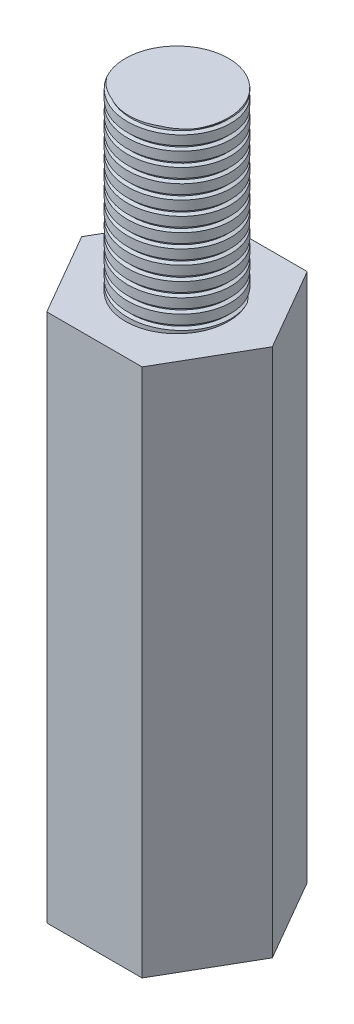
from build123d import *

# Parameters (mm, degrees)
SKETCH_1_R          = 1.46
EXTRUDE_1_DEPTH     = 15
SKETCH_1_3_R        = 1.46
CUT_EXTRUDE_1_DEPTH = 5
SKETCH_2_R          = 1.46
EXTRUDE_2_DEPTH     = 5
SWEEP_1_PITCH       = 0.4
SWEEP_1_FROM        = -0.1
SWEEP_2_PITCH       = 0.4


with BuildPart() as part:
    # 草图1 → 凸台-拉伸1 (new body)
    # profile 1 of 2: a face of its own
    with BuildSketch(Plane(origin=(0, 0, 0), x_dir=(1, 0, 0), z_dir=(0, 1, 0))):
        Polygon((-2.70199926, 0), (-1.35099963, -2.34), (1.35099963, -2.34), (2.70199926, 0), (1.35099963, 2.34), (-1.35099963, 2.34), align=None)
        Circle(SKETCH_1_R, mode=Mode.SUBTRACT)
    # profile 2 of 2: a face of its own
    with BuildSketch(Plane(origin=(0, 0, 0), x_dir=(1, 0, 0), z_dir=(0, 1, 0))):
        Circle(SKETCH_1_R)
    extrude(amount=EXTRUDE_1_DEPTH)

    # 草图1<3> → 切除-拉伸1 (cut)
    with BuildSketch(Plane(origin=(0, 0, 0), x_dir=(1, 0, 0), z_dir=(0, 1, 0))):
        with Locations(Location((0, 0, 0), (0, 0, 270))):
            Circle(SKETCH_1_3_R)
    extrude(amount=CUT_EXTRUDE_1_DEPTH, mode=Mode.SUBTRACT)

    # 切除-扫描2: arcs per turn and ends read off the stored shape
    # 切除-扫描2: the profile of 草图7 profile screwed along a right-hand helix through 23.75 turns, 6 arcs to a turn; built about Z, then put on its axis
    sweep_2_z = Axis((0, 0, 0), (0, 0, 1))
    sweep_2_corners = [(1.4597, 0, 0.1001), (1.66, 0, 0.033333333), (1.66, 0, -0.033333333), (1.4597, 0, -0.1001)]
    with BuildLine(mode=Mode.PRIVATE) as sweep_2_profile:
        Line(sweep_2_corners[0], sweep_2_corners[1])
        Line(sweep_2_corners[1], sweep_2_corners[2])
        Line(sweep_2_corners[2], sweep_2_corners[3])
        Line(sweep_2_corners[3], sweep_2_corners[0])
    sweep_2_cap = Face(sweep_2_profile.wire())
    sweep_2_turn_angles = [0, 30, 60, 90, 120, 150, 180, 210, 240, 270, 300, 330, 360]
    sweep_2_turn_weights = [1, 0.8660254037844387, 1, 0.8660254037844387, 1, 0.8660254037844387, 1, 0.8660254037844387, 1, 0.8660254037844387, 1, 0.8660254037844387, 1]
    sweep_2_turn_rails = [Edge.make_bspline([Vector(p[0], p[1], 0).rotate(sweep_2_z, sweep_2_turn_angles[k]) / sweep_2_turn_weights[k] + Vector(0, 0, p[2] + SWEEP_2_PITCH * sweep_2_turn_angles[k] / 360) for k in range(13)], [0, 0, 0, 1, 1, 2, 2, 3, 3, 4, 4, 5, 5, 6, 6, 6], 2, sweep_2_turn_weights) for p in sweep_2_corners]
    sweep_2_turn_sides = [Face.make_surface_from_curves(sweep_2_turn_rails[p[0]], sweep_2_turn_rails[p[1]]) for p in [(0, 1), (1, 2), (2, 3), (3, 0)]]
    sweep_2_last_angles = [8280, 8310, 8340, 8370, 8400, 8430, 8460, 8490, 8520, 8535, 8550]
    sweep_2_last_weights = [1, 0.8660254037844387, 1, 0.8660254037844387, 1, 0.8660254037844387, 1, 0.8660254037844387, 1, 0.965925826289056, 1]
    sweep_2_last_rails = [Edge.make_bspline([Vector(p[0], p[1], 0).rotate(sweep_2_z, sweep_2_last_angles[k]) / sweep_2_last_weights[k] + Vector(0, 0, p[2] + SWEEP_2_PITCH * sweep_2_last_angles[k] / 360) for k in range(11)], [0, 0, 0, 1, 1, 2, 2, 3, 3, 4, 4, 5, 5, 5], 2, sweep_2_last_weights) for p in sweep_2_corners]
    sweep_2_last_sides = [Face.make_surface_from_curves(sweep_2_last_rails[p[0]], sweep_2_last_rails[p[1]]) for p in [(0, 1), (1, 2), (2, 3), (3, 0)]]
    sweep_2 = Plane(origin=(0, 0, 0), x_dir=(0, 0, -1), z_dir=(0, 1, 0)) * Solid(Shell([*[p.moved(Location((0, 0, SWEEP_2_PITCH * i))) for i in range(23) for p in sweep_2_turn_sides], *sweep_2_last_sides, sweep_2_cap, sweep_2_cap.rotate(sweep_2_z, 8550).moved(Location((0, 0, SWEEP_2_PITCH * 8550 / 360)))]))
    add(sweep_2, mode=Mode.SUBTRACT)


with BuildPart() as body_2:
    # 草图2 → 凸台-拉伸2 (new body)
    with BuildSketch(Plane(origin=(0, 15, 0), x_dir=(1, 0, 0), z_dir=(0, 1, 0))):
        with Locations(Location((0, 0, 0), (0, 0, 270))):
            Circle(SKETCH_2_R)
    extrude(amount=EXTRUDE_2_DEPTH)

    # 切除-扫描1: arcs per turn and ends read off the stored shape
    # 切除-扫描1: the profile of 草图4 screwed along a left-hand helix through 18.75 turns, 6 arcs to a turn; built about Z, then put on its axis
    sweep_1_z = Axis((0, 0, 0), (0, 0, 1))
    sweep_1_corners = [(1.56, 5.45e-07, -0.400000022), (1.56, 5.45e-07, -0.200000022), (1.36, 4.75e-07, -0.266666689), (1.36, 4.75e-07, -0.333333356)]
    with BuildLine(mode=Mode.PRIVATE) as sweep_1_profile:
        Line(sweep_1_corners[0], sweep_1_corners[1])
        Line(sweep_1_corners[1], sweep_1_corners[2])
        Line(sweep_1_corners[2], sweep_1_corners[3])
        Line(sweep_1_corners[3], sweep_1_corners[0])
    sweep_1_cap = Face(sweep_1_profile.wire())
    sweep_1_turn_angles = [0, -30, -60, -90, -120, -150, -180, -210, -240, -270, -300, -330, -360]
    sweep_1_turn_weights = [1, 0.8660254037844387, 1, 0.8660254037844387, 1, 0.8660254037844387, 1, 0.8660254037844387, 1, 0.8660254037844387, 1, 0.8660254037844387, 1]
    sweep_1_turn_rails = [Edge.make_bspline([Vector(p[0], p[1], 0).rotate(sweep_1_z, sweep_1_turn_angles[k]) / sweep_1_turn_weights[k] + Vector(0, 0, p[2] + -SWEEP_1_PITCH * sweep_1_turn_angles[k] / 360) for k in range(13)], [0, 0, 0, 1, 1, 2, 2, 3, 3, 4, 4, 5, 5, 6, 6, 6], 2, sweep_1_turn_weights) for p in sweep_1_corners]
    sweep_1_turn_sides = [Face.make_surface_from_curves(sweep_1_turn_rails[p[0]], sweep_1_turn_rails[p[1]]) for p in [(0, 1), (1, 2), (2, 3), (3, 0)]]
    sweep_1_last_angles = [-6480, -6510, -6540, -6570, -6600, -6630, -6660, -6690, -6720, -6735, -6750]
    sweep_1_last_weights = [1, 0.8660254037844387, 1, 0.8660254037844387, 1, 0.8660254037844387, 1, 0.8660254037844387, 1, 0.9659258262889348, 1]
    sweep_1_last_rails = [Edge.make_bspline([Vector(p[0], p[1], 0).rotate(sweep_1_z, sweep_1_last_angles[k]) / sweep_1_last_weights[k] + Vector(0, 0, p[2] + -SWEEP_1_PITCH * sweep_1_last_angles[k] / 360) for k in range(11)], [0, 0, 0, 1, 1, 2, 2, 3, 3, 4, 4, 5, 5, 5], 2, sweep_1_last_weights) for p in sweep_1_corners]
    sweep_1_last_sides = [Face.make_surface_from_curves(sweep_1_last_rails[p[0]], sweep_1_last_rails[p[1]]) for p in [(0, 1), (1, 2), (2, 3), (3, 0)]]
    sweep_1 = Plane(origin=(0, 15.1, 0), x_dir=(0, 0, 1), z_dir=(0, 1, 0)) * split(Solid(Shell([*[p.moved(Location((0, 0, SWEEP_1_PITCH * i))) for i in range(18) for p in sweep_1_turn_sides], *sweep_1_last_sides, sweep_1_cap, sweep_1_cap.rotate(sweep_1_z, -6750).moved(Location((0, 0, -SWEEP_1_PITCH * -6750 / 360)))])), bisect_by=Plane.XY.offset(SWEEP_1_FROM), keep=Keep.TOP, mode=Mode.PRIVATE)
    add(sweep_1, mode=Mode.SUBTRACT)


solid = Compound([part.part, body_2.part])
